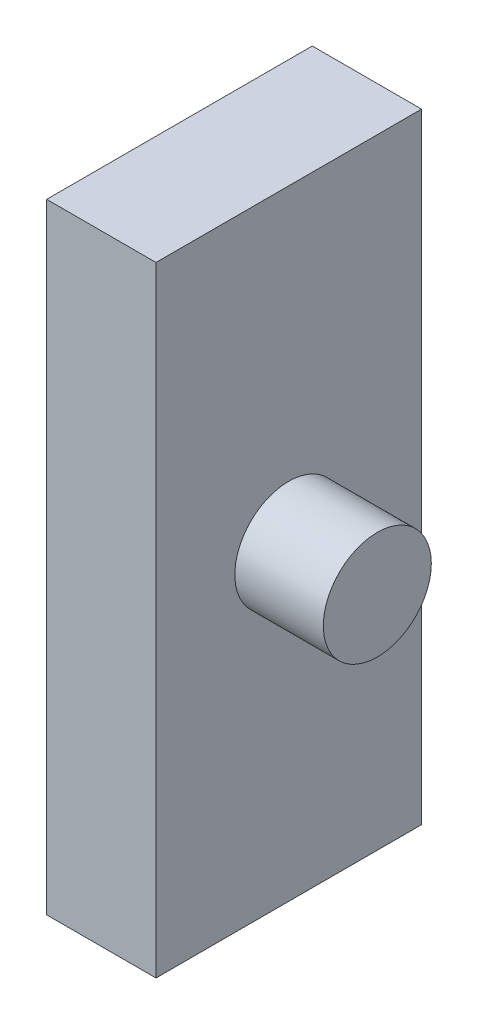
from build123d import *

# Parameters (mm, degrees)
SKETCH1_W           = 15
SKETCH1_H           = 35
SKETCH1_W_2         = 3.175
SKETCH1_H_2         = 13
BOSS_EXTRUDE1_DEPTH = 4.175
SKETCH2_W           = 15
SKETCH2_H           = 35
BOSS_EXTRUDE2_DEPTH = 2
SKETCH3_R           = 3.05
BOSS_EXTRUDE3_DEPTH = 5


with BuildPart() as part:
    # Sketch1 → Boss-Extrude1 (new body)
    with BuildSketch(Plane(origin=(0, 0, 0), x_dir=(0, 0, -1), z_dir=(1, 0, 0))):
        with Locations((7.5, 17.5)):
            Rectangle(SKETCH1_W, SKETCH1_H)
        with Locations((7.5, 17.5)):
            Rectangle(SKETCH1_W_2, SKETCH1_H_2, mode=Mode.SUBTRACT)
    extrude(amount=BOSS_EXTRUDE1_DEPTH)

    # Sketch2 → Boss-Extrude2 (add)
    with BuildSketch(Plane(origin=(4.175, 0, 0), x_dir=(0, 0, -1), z_dir=(1, 0, 0))):
        with Locations((7.5, 17.5)):
            Rectangle(SKETCH2_W, SKETCH2_H)
    extrude(amount=BOSS_EXTRUDE2_DEPTH)

    # Sketch3 → Boss-Extrude3 (add)
    with BuildSketch(Plane(origin=(6.175, 0, 0), x_dir=(0, 0, -1), z_dir=(1, 0, 0))):
        with Locations((7.5, 17.5)):
            Circle(SKETCH3_R)
    extrude(amount=BOSS_EXTRUDE3_DEPTH)


solid = part.part
